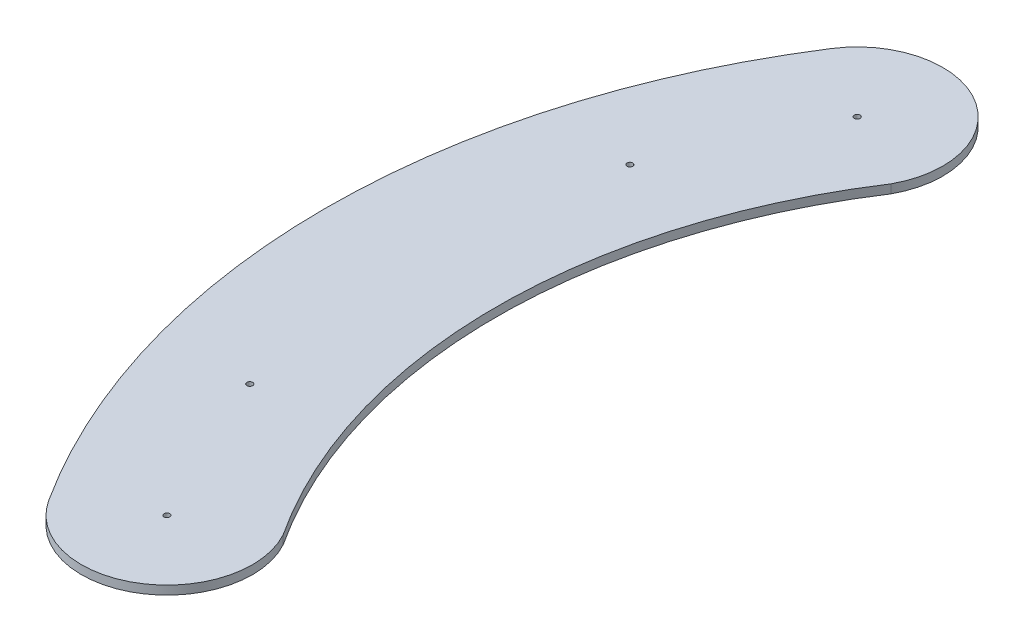
from build123d import *

# Parameters (mm, degrees)
ESQUISSE1_R        = 1
BOSS_EXTRU_1_DEPTH = 3


with BuildPart() as part:
    # Esquisse1 → Boss.-Extru.1 (new body)
    with BuildSketch(Plane(origin=(0, 0, 0), x_dir=(1, 0, 0), z_dir=(0, 1, 0))):
        with BuildLine():
            ThreePointArc((-159.775094034, -104.798980998), (-191.078274777, 0), (-159.775094034, 104.798980998))
            ThreePointArc((-159.775094034, 104.798980998), (-170.562538352, 144.360608571), (-210.467152479, 134.920634921))
            ThreePointArc((-210.467152479, 134.920634921), (-250, 0), (-210.467152479, -134.920634921))
            ThreePointArc((-210.467152479, -134.920634921), (-170.562538352, -144.360608571), (-159.775094034, -104.798980998))
        make_face()
        with Locations((-185.632028486, 119)):
            Circle(ESQUISSE1_R, mode=Mode.SUBTRACT)
        with Locations((-210.541823555, 65.516337918)):
            Circle(ESQUISSE1_R, mode=Mode.SUBTRACT)
        with Locations((-210.541823555, -65.516337918)):
            Circle(ESQUISSE1_R, mode=Mode.SUBTRACT)
        with Locations((-185.632028486, -119)):
            Circle(ESQUISSE1_R, mode=Mode.SUBTRACT)
    extrude(amount=BOSS_EXTRU_1_DEPTH)


solid = part.part
